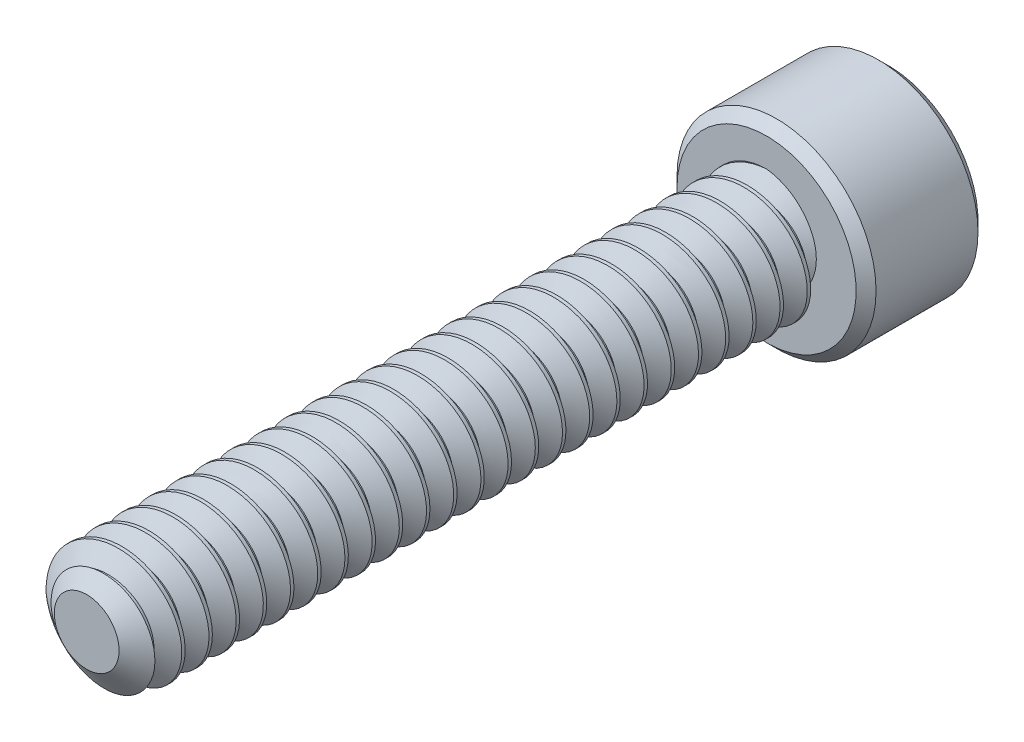
from build123d import *

# Parameters (mm, degrees)
SKETCH1_R          = 1.4224
EXTRUDE1_DEPTH     = 15.875
CUT_SWEEP1_PITCH   = 0.635
SKETCH6_R          = 2.3241
EXTRUDE2_DEPTH     = 2.8448
CUT_EXTRUDE1_DEPTH = 1.7859375
CHAMFER1_SIZE      = 0.23241


with BuildPart() as part:
    # Sketch1 → Extrude1 (new body)
    with BuildSketch(Plane.XY):
        Circle(SKETCH1_R)
    extrude(amount=-EXTRUDE1_DEPTH)

    # Cut-Sweep1: the profile of Sketch3 profile screwed along a right-hand helix of 26 turns, 6 arcs to a turn; built about Z, then put on its axis
    cut_sweep1_z = Axis((0, 0, 0), (0, 0, 1))
    cut_sweep1_corners = [(1.4227, 0, -0.555798205), (1.009955401, 0, -0.3175), (1.009955401, 0, -0.238125), (1.4227, 0, 0.000173205)]
    with BuildLine(mode=Mode.PRIVATE) as cut_sweep1_profile:
        Line(cut_sweep1_corners[0], cut_sweep1_corners[1])
        Line(cut_sweep1_corners[1], cut_sweep1_corners[2])
        Line(cut_sweep1_corners[2], cut_sweep1_corners[3])
        Line(cut_sweep1_corners[3], cut_sweep1_corners[0])
    cut_sweep1_cap = Face(cut_sweep1_profile.wire())
    cut_sweep1_turn_angles = [0, 30, 60, 90, 120, 150, 180, 210, 240, 270, 300, 330, 360]
    cut_sweep1_turn_weights = [1, 0.8660254037844387, 1, 0.8660254037844387, 1, 0.8660254037844387, 1, 0.8660254037844387, 1, 0.8660254037844387, 1, 0.8660254037844387, 1]
    cut_sweep1_turn_rails = [Edge.make_bspline([Vector(p[0], p[1], 0).rotate(cut_sweep1_z, cut_sweep1_turn_angles[k]) / cut_sweep1_turn_weights[k] + Vector(0, 0, p[2] + CUT_SWEEP1_PITCH * cut_sweep1_turn_angles[k] / 360) for k in range(13)], [0, 0, 0, 1, 1, 2, 2, 3, 3, 4, 4, 5, 5, 6, 6, 6], 2, cut_sweep1_turn_weights) for p in cut_sweep1_corners]
    cut_sweep1_turn_sides = [Face.make_surface_from_curves(cut_sweep1_turn_rails[p[0]], cut_sweep1_turn_rails[p[1]]) for p in [(0, 1), (1, 2), (2, 3), (3, 0)]]
    cut_sweep1 = Plane(origin=(0, 0, 0), x_dir=(0, 1, 0), z_dir=(0, 0, -1)) * Solid(Shell([*[p.moved(Location((0, 0, CUT_SWEEP1_PITCH * i))) for i in range(26) for p in cut_sweep1_turn_sides], cut_sweep1_cap, cut_sweep1_cap.rotate(cut_sweep1_z, 9360).moved(Location((0, 0, CUT_SWEEP1_PITCH * 9360 / 360)))]))
    add(cut_sweep1, mode=Mode.SUBTRACT)

    # Sketch4 → Cut-Revolve1 (revolve, cut)
    with BuildSketch(Plane(origin=(0, 0, 0), x_dir=(0, 0, -1), z_dir=(1, 0, 0)), mode=Mode.PRIVATE) as cut_revolve1_sk:
        Polygon((0.466649532, 1.4224), (0, 0.755955401), (0, 1.4224), align=None)
    revolve(cut_revolve1_sk.sketch.rotate(Axis((0, 0, 0), (0, 0, -1)), 264.795368264), axis=Axis((0, 0, 0), (0, 0, -1)), mode=Mode.SUBTRACT)

    # Sketch6 → Extrude2 (add)
    with BuildSketch(Plane(origin=(0, 0, -15.875), x_dir=(-1, 0, 0), z_dir=(0, 0, -1))):
        Circle(SKETCH6_R)
    extrude(amount=EXTRUDE2_DEPTH)

    # Sketch7 → Cut-Extrude1 (cut)
    with BuildSketch(Plane(origin=(0, 0, -18.7198), x_dir=(-1, 0, 0), z_dir=(0, 0, -1))):
        Polygon((0, 1.374815329), (-1.190625, 0.687407664), (-1.190625, -0.687407664), (0, -1.374815329), (1.190625, -0.687407664), (1.190625, 0.687407664), align=None)
    extrude(amount=-CUT_EXTRUDE1_DEPTH, mode=Mode.SUBTRACT)

    # Cut-Extrude2 cone 1 section (through the dimple's axis) → Cut-Extrude2 (revolve, cut)
    with BuildSketch(Plane(origin=(0, 0, -18.7198), x_dir=(0, 1, 0), z_dir=(1, 0, 0))):
        Polygon((0, 0), (1.374815329, 0), (0, 1.374815329), align=None)
    revolve(axis=Axis((0, 0, -18.7198), (0, 0, 1)), mode=Mode.SUBTRACT)

    # Chamfer1
    chamfer1_edges = [part.edges().sort_by_distance(p)[0] for p in [
        (2.3241, 0, -15.875),
        (2.3241, 0, -18.7198),
    ]]
    chamfer(chamfer1_edges, length=CHAMFER1_SIZE)


solid = part.part
